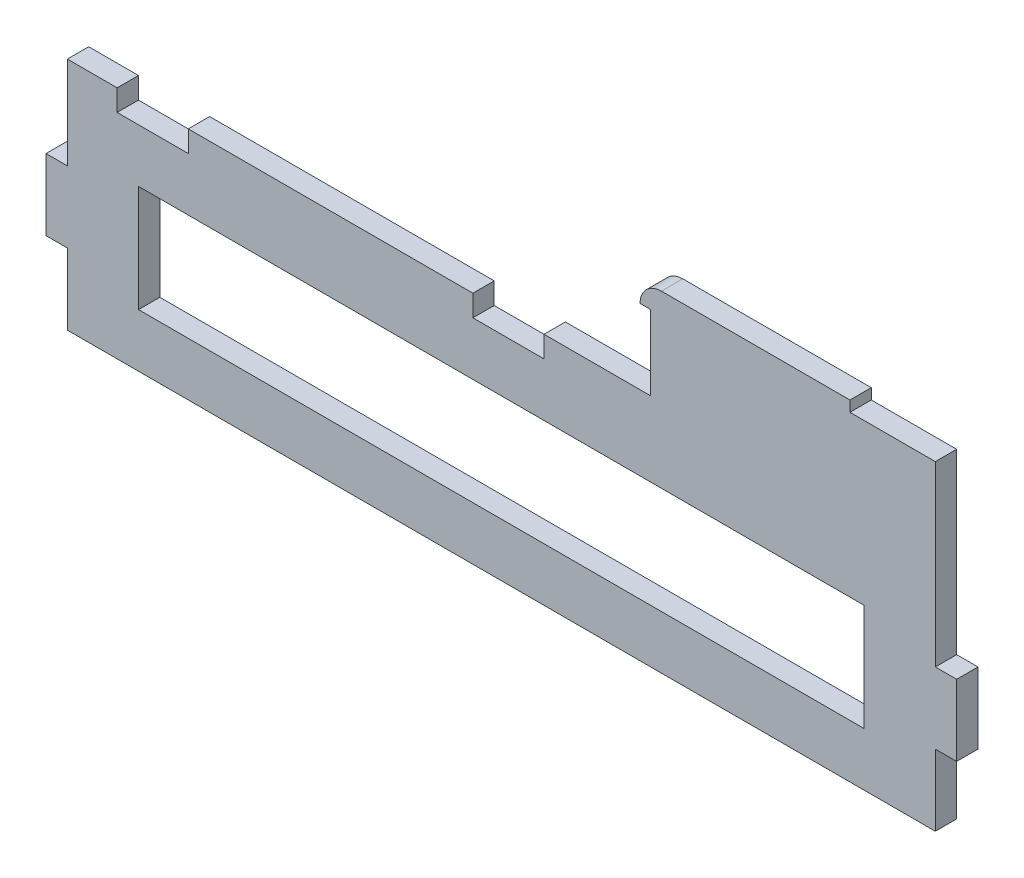
from build123d import *

# Parameters (mm, degrees)
SKETCH_1_W      = 204
SKETCH_1_H      = 30
EXTRUDE_1_DEPTH = 6
FILLET_2_R      = 6


with BuildPart() as part:
    # Эскиз1 → Бобышка-Вытянуть1 (new body)
    with BuildSketch(Plane.XY):
        Polygon((0, 20), (0, 0), (244, 0), (244, 20), (250, 20), (250, 40), (244, 40), (244, 90), (220, 90), (220, 93), (161, 93), (161, 87), (164, 87), (164, 66), (134, 66), (134, 60), (114, 60), (114, 66), (34, 66), (34, 60), (14, 60), (14, 66), (0, 66), (0, 40), (-6, 40), (-6, 20), align=None)
        with Locations((122, 30)):
            Rectangle(SKETCH_1_W, SKETCH_1_H, mode=Mode.SUBTRACT)
    extrude(amount=EXTRUDE_1_DEPTH)

    # Скругление2
    fillet_2_edges = [part.edges().sort_by_distance(p)[0] for p in [
        (161, 93, 3),
    ]]
    fillet(fillet_2_edges, radius=FILLET_2_R - 0.0001)  # a hair under: the kernel refuses the full size


solid = part.part
